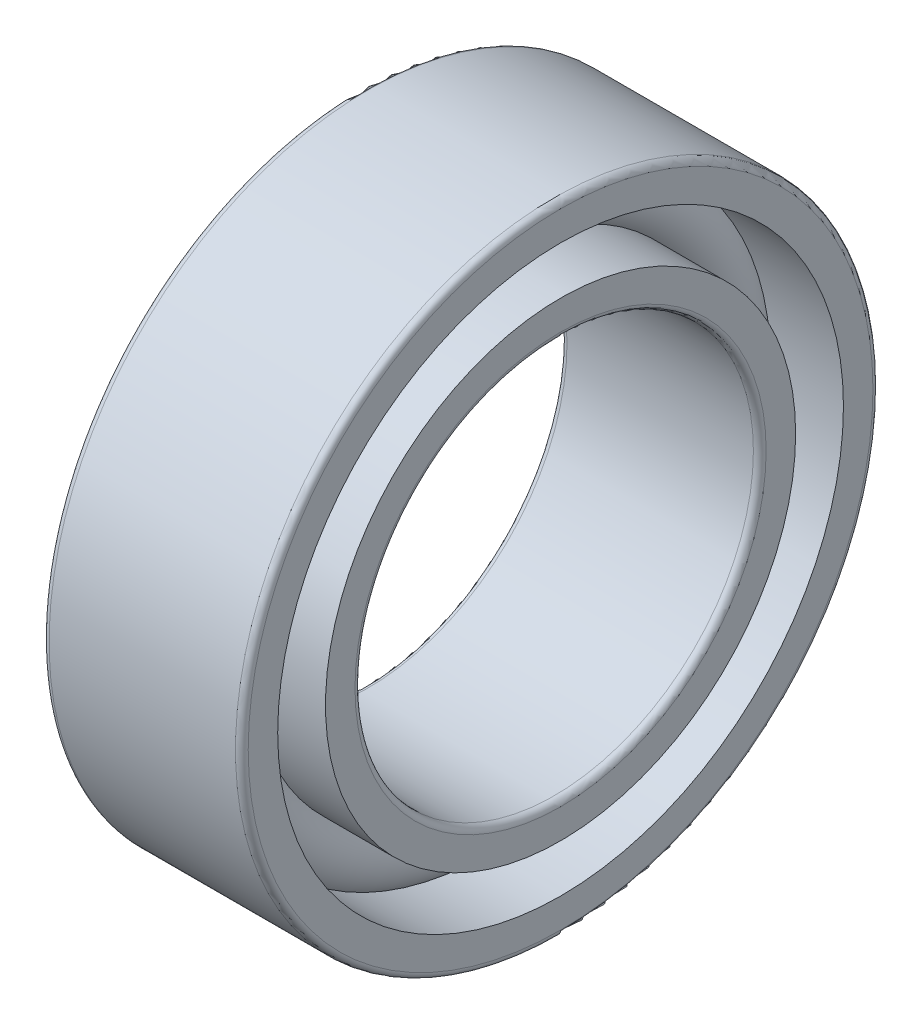
from build123d import *

# Parameters (mm, degrees)
CAGSPISKE_W     = 0.142875
CAGSPISKE_H     = 0.238125
CAGESPINE_ANGLE = 0.001
BALSIMSKE_R     = 0.714375


with BuildPart() as part:
    # CagSpiSke → CageSpine (revolve)
    with BuildSketch(Plane.XY):
        with Locations((0, 5.159375)):
            Rectangle(CAGSPISKE_W, CAGSPISKE_H)
    revolve(axis=Axis((-20.6375, 0, 0), (-1, 0, 0)), revolution_arc=CAGESPINE_ANGLE)

    # BalSimSke → BallsSimplified (revolve)
    with BuildSketch(Plane.XY):
        with Locations((0, 5.159375)):
            Circle(BALSIMSKE_R)
    revolve(axis=Axis((-10, 0, 0), (1, 0, 0)))

    # InnRacSke → InnerRace (revolve)
    with BuildSketch(Plane.XY):
        with BuildLine():
            Line((-0.472467942, 4.683125), (-1.98374, 4.683125))
            Line((-1.98374, 4.683125), (-1.98374, 4.09575))
            ThreePointArc((-1.98374, 4.09575), (-1.946542561, 4.005947439), (-1.85674, 3.96875))
            Line((-1.85674, 3.96875), (1.85674, 3.96875))
            ThreePointArc((1.85674, 3.96875), (1.946542561, 4.005947439), (1.98374, 4.09575))
            Line((1.98374, 4.09575), (1.98374, 4.683125))
            Line((1.98374, 4.683125), (0.523267942, 4.683125))
            ThreePointArc((0.523267942, 4.683125), (0.0254, 4.4704), (-0.472467942, 4.683125))
        make_face()
    revolve(axis=Axis((-20.6375, 0, 0), (1, 0, 0)))

    # OutRacSke → OuterRace (revolve)
    with BuildSketch(Plane.XY):
        with BuildLine():
            Line((-0.497867942, 5.635625), (-1.98374, 5.635625))
            Line((-1.98374, 5.635625), (-1.98374, 6.223))
            ThreePointArc((-1.98374, 6.223), (-1.946542561, 6.312802561), (-1.85674, 6.35))
            Line((-1.85674, 6.35), (1.85674, 6.35))
            ThreePointArc((1.85674, 6.35), (1.946542561, 6.312802561), (1.98374, 6.223))
            Line((1.98374, 6.223), (1.98374, 5.635625))
            Line((1.98374, 5.635625), (0.497867942, 5.635625))
            ThreePointArc((0.497867942, 5.635625), (0, 5.84835), (-0.497867942, 5.635625))
        make_face()
    revolve(axis=Axis((-20.6375, 0, 0), (1, 0, 0)))


solid = part.part
